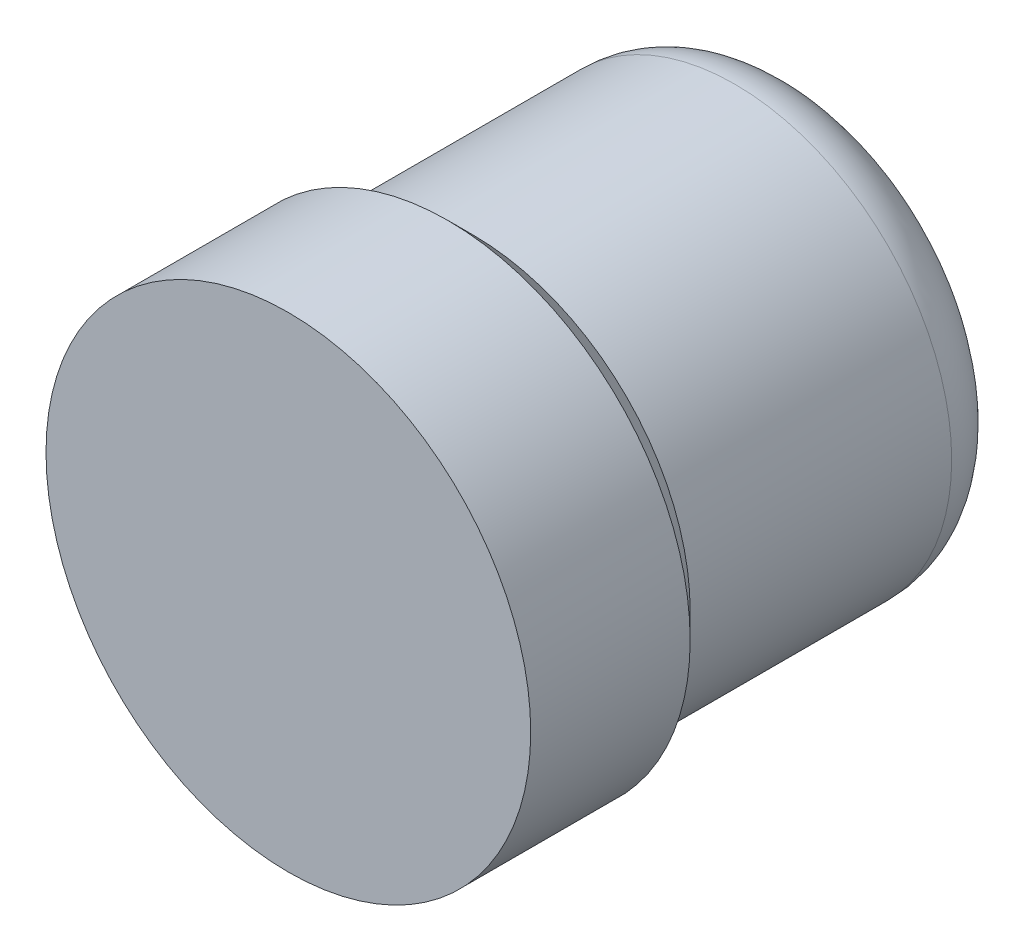
from build123d import *

# Parameters (mm, degrees)
SKETCH1_R           = 3.8
BOSS_EXTRUDE1_DEPTH = 3
SKETCH2_R           = 3.4
BOSS_EXTRUDE2_DEPTH = 5
FILLET1_R           = 1
CHAMFER1_SIZE       = 0.5


with BuildPart() as part:
    # Sketch1 → Boss-Extrude1 (new body)
    with BuildSketch(Plane.XY):
        with Locations((0, 21.5)):
            Circle(SKETCH1_R)
    extrude(amount=-BOSS_EXTRUDE1_DEPTH)

    # Sketch2 → Boss-Extrude2 (add)
    with BuildSketch(Plane(origin=(0, 0, -3), x_dir=(-1, 0, 0), z_dir=(0, 0, -1))):
        with Locations((0, 21.5)):
            Circle(SKETCH2_R)
    extrude(amount=BOSS_EXTRUDE2_DEPTH)

    # Fillet1
    fillet1_edges = [part.edges().sort_by_distance(p)[0] for p in [
        (3.4, 21.5, -8),
    ]]
    fillet(fillet1_edges, radius=FILLET1_R)

    # Chamfer1
    # the kernel refuses this chamfer: 0.5 mm, written as the material it takes off along each edge
    with BuildSketch(Plane(origin=(0, 21.5, -3), x_dir=(1, 0, 0), z_dir=(0, -1, 0))) as chamfer1_piece_1_section:
        Polygon((3.8 - CHAMFER1_SIZE, 0), (3.8, CHAMFER1_SIZE), (3.8, 0), align=None)
    chamfer1_piece_1 = revolve(axis=Axis((0, 21.5, -3), (0, 0, 1)), mode=Mode.PRIVATE)
    chamfer1_piece_1 = chamfer1_piece_1 - Plane(origin=(0, 21.5, -2.703116332), x_dir=(-1, 0, 0), z_dir=(0, 0, 1)) * Cylinder(3.4, 16, mode=Mode.PRIVATE)
    add(chamfer1_piece_1, mode=Mode.SUBTRACT)


solid = part.part
